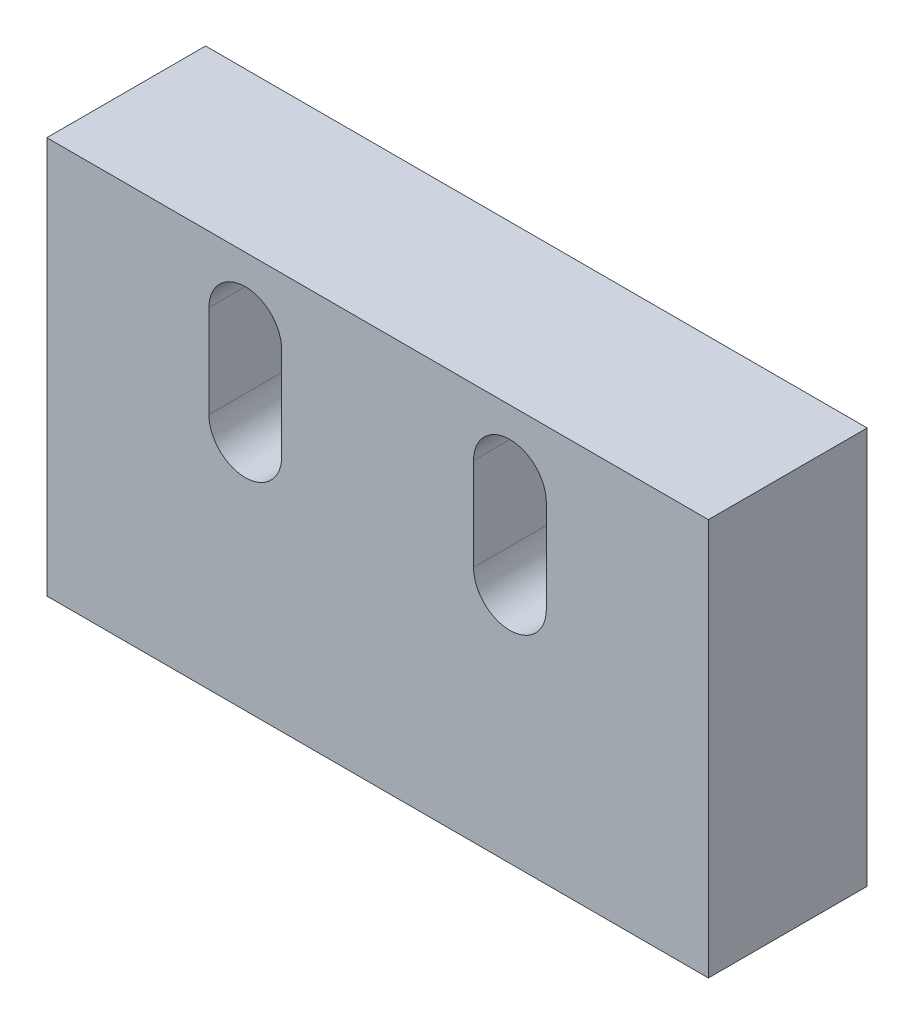
from build123d import *

# Parameters (mm, degrees)
SKETCH1_W                = 50
SKETCH1_H                = 30
BOSS_EXTRUDE1_DEPTH      = 6
M5_START                 = -6
M5_CLEARANCE_SLOT1_DEPTH = 12


# Read off the part's stored shape, not the designer's step: M5 Clearance Slot1
with BuildPart() as part:
    # Sketch1 → Boss-Extrude1 (new, symmetric)
    with BuildSketch(Plane.XY):
        Rectangle(SKETCH1_W, SKETCH1_H)
    extrude(amount=BOSS_EXTRUDE1_DEPTH, both=True)

    # M5 Clearance Slot1 outline → M5 Clearance Slot1 (cut)
    with BuildSketch(Plane.XY.offset(M5_START)):
        with BuildLine():
            Line((7.25, 10), (7.25, 3))
            ThreePointArc((7.25, 3), (10, 0.25), (12.75, 3))
            Line((12.75, 3), (12.75, 10))
            ThreePointArc((12.75, 10), (10, 12.75), (7.25, 10))
        make_face()
        with BuildLine():
            Line((-12.75, 10), (-12.75, 3))
            ThreePointArc((-12.75, 3), (-10, 0.25), (-7.25, 3))
            Line((-7.25, 3), (-7.25, 10))
            ThreePointArc((-7.25, 10), (-10, 12.75), (-12.75, 10))
        make_face()
    extrude(amount=M5_CLEARANCE_SLOT1_DEPTH, mode=Mode.SUBTRACT)

    # Sketch5 → M5x0.8 Tapped Hole1 (revolve, cut)
    with BuildSketch(Plane(origin=(15, -15, 0), x_dir=(0, 0, -1), z_dir=(1, 0, 0))):
        Polygon((0, 0), (0, 8.4), (2.1, 7.1381927), (2.1, 0), align=None)
    m5x0_8_tapped_hole1 = revolve(axis=Axis((15, -21.35, 0), (0, 1, 0)), mode=Mode.SUBTRACT)

    # Mirror1: M5x0.8 Tapped Hole1 across plane
    add(m5x0_8_tapped_hole1.mirror(Plane(origin=(0, 0, 0), x_dir=(0, 0, 1), z_dir=(1, 0, 0))), mode=Mode.SUBTRACT)


solid = part.part
